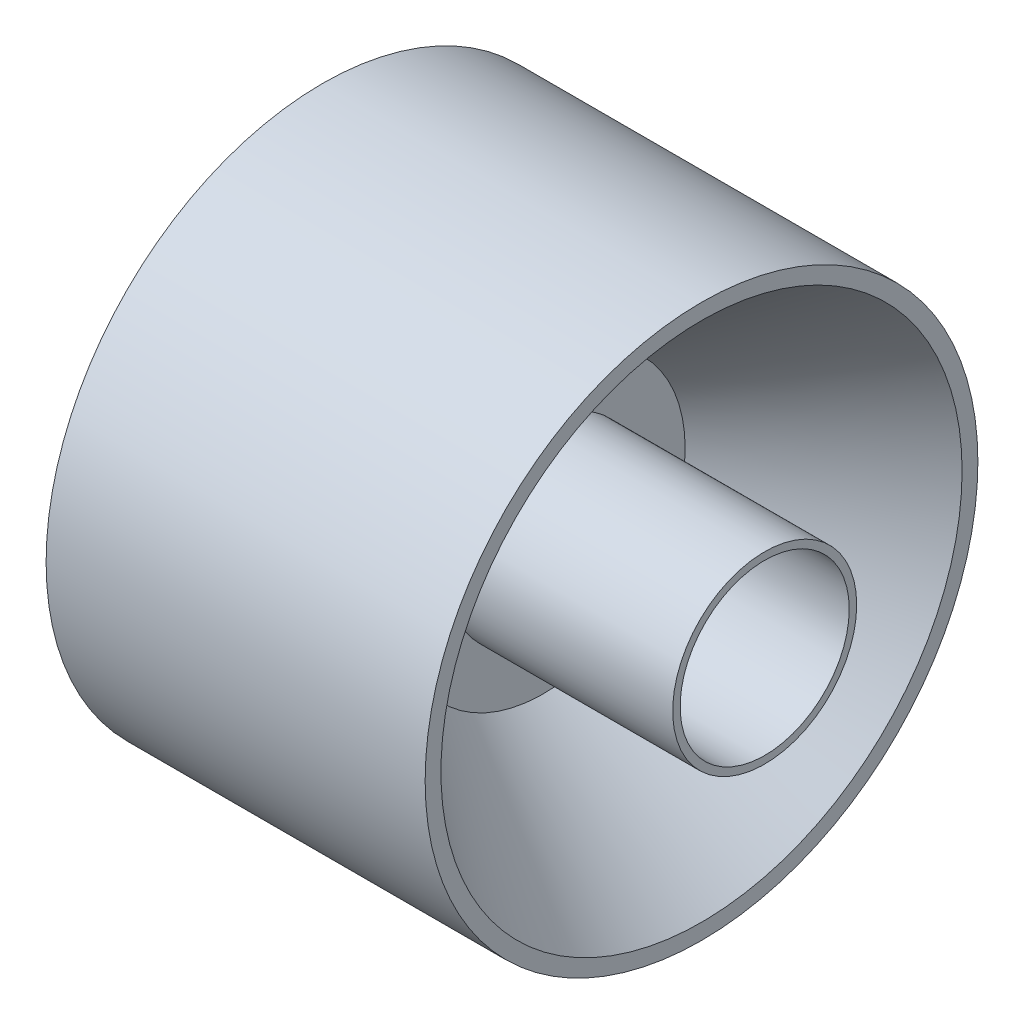
from build123d import *

# Parameters (mm, degrees)
SKETCH1_R           = 55.5625
BOSS_EXTRUDE1_DEPTH = 76.2
SKETCH2_R           = 52.3875
CUT_EXTRUDE1_DEPTH  = 31.75
CUT_EXTRUDE1_DRAFT  = -37
SKETCH3_R           = 52.3875
CUT_EXTRUDE2_DEPTH  = 31.75
CUT_EXTRUDE2_DRAFT  = -37
SKETCH4_R           = 18.5
SKETCH4_R_2         = 17
BOSS_EXTRUDE2_DEPTH = 44.45


with BuildPart() as part:
    # Sketch1 → Boss-Extrude1 (new body)
    with BuildSketch(Plane(origin=(0, 0, 0), x_dir=(0, 0, -1), z_dir=(1, 0, 0))):
        Circle(SKETCH1_R)
    extrude(amount=BOSS_EXTRUDE1_DEPTH)


with BuildPart() as cut_extrude1_tool:
    # Sketch2 → Cut-Extrude1 (with draft: the straight prism first)
    with BuildSketch(Plane(origin=(76.2, 0, 0), x_dir=(0, 0, -1), z_dir=(1, 0, 0))):
        Circle(SKETCH2_R)
    extrude(amount=-CUT_EXTRUDE1_DEPTH)
    # Cut-Extrude1: the draft: its side faces are tilted about the plane it starts from
    cut_extrude1_sides = [cut_extrude1_tool.faces().sort_by_distance(p)[0] for p in [
        (60.325, 0, 52.3875),
    ]]
    draft(cut_extrude1_sides, Plane(origin=(76.2, 0, 0), x_dir=(0, 0, -1), z_dir=(1, 0, 0)), CUT_EXTRUDE1_DRAFT)


with BuildPart() as part_1:
    add(part.part)

    # Cut-Extrude1: cut by cut_extrude1_tool
    add(cut_extrude1_tool.part, mode=Mode.SUBTRACT)


with BuildPart() as cut_extrude2_tool:
    # Sketch3 → Cut-Extrude2 (with draft: the straight prism first)
    with BuildSketch(Plane.ZY):
        Circle(SKETCH3_R)
    extrude(amount=-CUT_EXTRUDE2_DEPTH)
    # Cut-Extrude2: the draft: its side faces are tilted about the plane it starts from
    cut_extrude2_sides = [cut_extrude2_tool.faces().sort_by_distance(p)[0] for p in [
        (15.875, 0, -52.3875),
    ]]
    draft(cut_extrude2_sides, Plane.ZY, CUT_EXTRUDE2_DRAFT)


with BuildPart() as part_2:
    add(part_1.part)

    # Cut-Extrude2: cut by cut_extrude2_tool
    add(cut_extrude2_tool.part, mode=Mode.SUBTRACT)

    # Sketch4 → Boss-Extrude2 (add)
    with BuildSketch(Plane(origin=(44.45, 0, 0), x_dir=(0, 0, -1), z_dir=(1, 0, 0))):
        Circle(SKETCH4_R)
        Circle(SKETCH4_R_2, mode=Mode.SUBTRACT)
    extrude(amount=BOSS_EXTRUDE2_DEPTH)


solid = part_2.part
